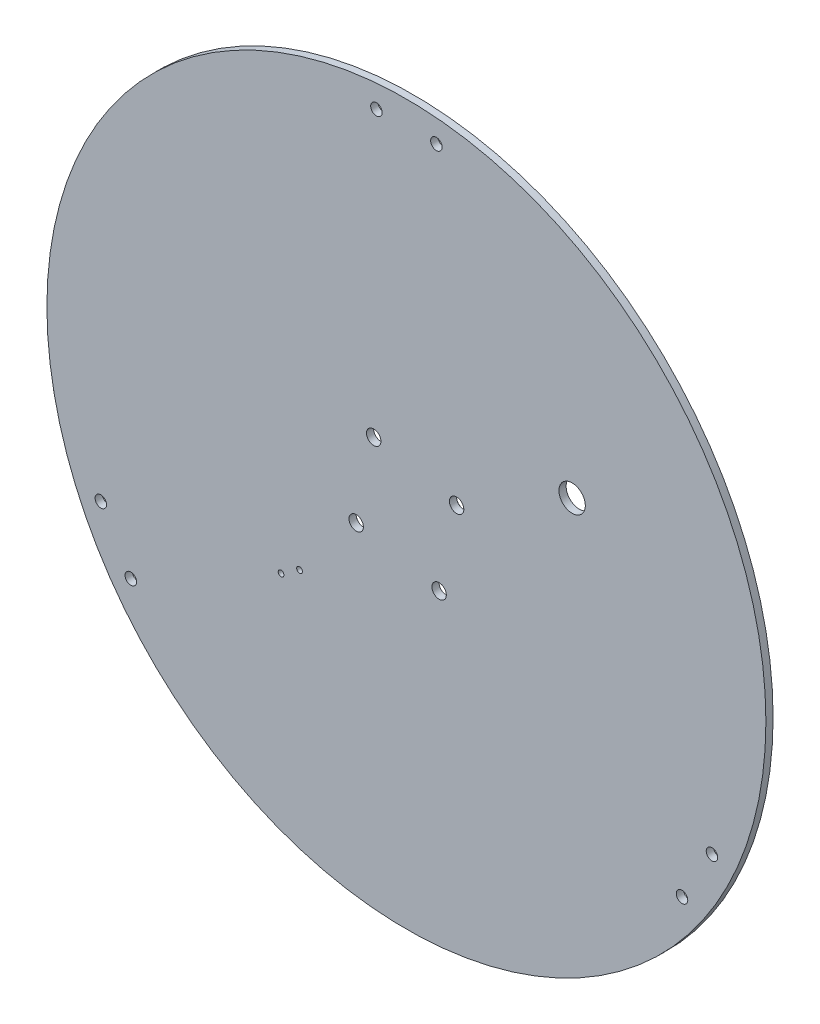
from build123d import *

# Parameters (mm, degrees)
SKETCH1_R                      = 150
SKETCH1_R_2                    = 2.4
SKETCH1_R_3                    = 5.5
SKETCH1_R_4                    = 1.2
BOSS_EXTRUDE2_DEPTH            = 3
F_6_0MM_DOWEL_HOLE1_AT_2_COUNT = 2
F_6_0MM_DOWEL_HOLE1_AT_2_PITCH = 35.355339059
F_6_0MM_DOWEL_HOLE1_AT_3_COUNT = 2
F_6_0MM_DOWEL_HOLE1_AT_3_PITCH = 50
F_6_0MM_DOWEL_HOLE1_AT_4_COUNT = 2
F_6_0MM_DOWEL_HOLE1_AT_4_PITCH = 35.355339059


with BuildPart() as part:
    # Sketch1 → Boss-Extrude2 (new body)
    with BuildSketch(Plane.XY):
        Circle(SKETCH1_R)
        with Locations((12.5, 140)):
            Circle(SKETCH1_R_2, mode=Mode.SUBTRACT)
        with Locations((-12.5, 140)):
            Circle(SKETCH1_R_2, mode=Mode.SUBTRACT)
        with Locations((127.49355653, -59.174682453)):
            Circle(SKETCH1_R_2, mode=Mode.SUBTRACT)
        with Locations((114.99355653, -80.825317547)):
            Circle(SKETCH1_R_2, mode=Mode.SUBTRACT)
        with Locations((-114.99355653, -80.825317547)):
            Circle(SKETCH1_R_2, mode=Mode.SUBTRACT)
        with Locations((-127.49355653, -59.174682453)):
            Circle(SKETCH1_R_2, mode=Mode.SUBTRACT)
        with Locations((69.145129734, 40.348269291)):
            Circle(SKETCH1_R_3, mode=Mode.SUBTRACT)
        with Locations((-44.588000359, -42.501161913)):
            Circle(SKETCH1_R_4, mode=Mode.SUBTRACT)
        with Locations((-52.288000359, -47.601161913)):
            Circle(SKETCH1_R_4, mode=Mode.SUBTRACT)
    extrude(amount=BOSS_EXTRUDE2_DEPTH)

    # Sketch9 → Ø6.0mm Dowel Hole1 (revolve, cut)
    with BuildSketch(Plane(origin=(20.948618643, 13.643876903, 0), x_dir=(0, 1, 0), z_dir=(1, 0, 0))):
        Polygon((0, 0), (0, 3), (3, 3), (3, 0.025), (3.025, 0), align=None)
    f_6_0mm_dowel_hole1 = revolve(axis=Axis((20.948618643, 13.643876903, -6.35), (0, 0, 1)), mode=Mode.SUBTRACT)

    # Ø6.0mm Dowel Hole1 at 2: Ø6.0mm Dowel Hole1 ×2
    with Locations(*[Vector(-0.9784235271434174, 0.20660929681946652, 0) * (i * F_6_0MM_DOWEL_HOLE1_AT_2_PITCH) for i in range(1, F_6_0MM_DOWEL_HOLE1_AT_2_COUNT)]):
        add(f_6_0mm_dowel_hole1, mode=Mode.SUBTRACT)

    # Ø6.0mm Dowel Hole1 at 3: Ø6.0mm Dowel Hole1 ×2
    with Locations(*[Vector(-0.8379447457527994, -0.5457550760783416, 0) * (i * F_6_0MM_DOWEL_HOLE1_AT_3_PITCH) for i in range(1, F_6_0MM_DOWEL_HOLE1_AT_3_COUNT)]):
        add(f_6_0mm_dowel_hole1, mode=Mode.SUBTRACT)

    # Ø6.0mm Dowel Hole1 at 4: Ø6.0mm Dowel Hole1 ×2
    with Locations(*[Vector(-0.2066092968194665, -0.9784235271434174, 0) * (i * F_6_0MM_DOWEL_HOLE1_AT_4_PITCH) for i in range(1, F_6_0MM_DOWEL_HOLE1_AT_4_COUNT)]):
        add(f_6_0mm_dowel_hole1, mode=Mode.SUBTRACT)


solid = part.part
